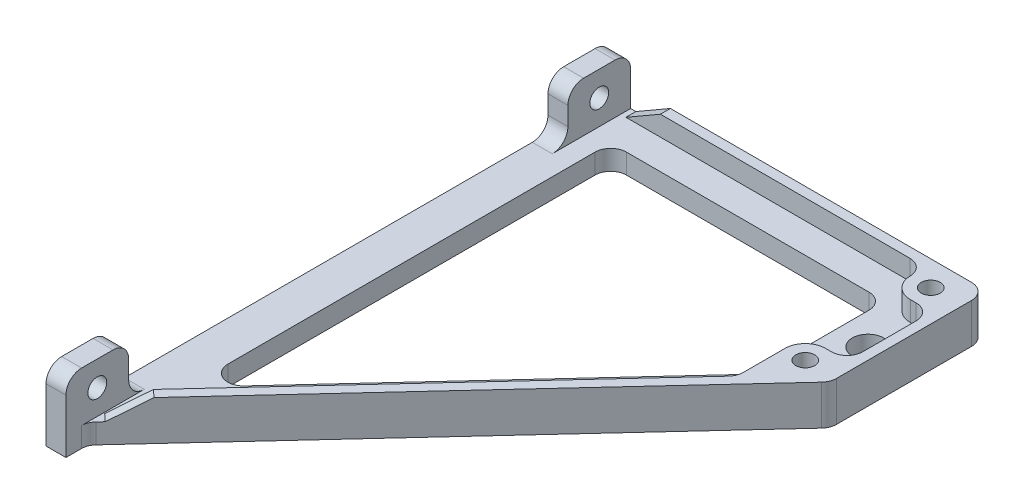
from build123d import *

# Parameters (mm, degrees)
BOSS_EXTRUDE1_DEPTH = 6.35
SKETCH2_R           = 3
CUT_EXTRUDE3_DEPTH  = 217.426251873
BOSS_EXTRUDE3_DEPTH = 6.35
CHAMFER1_SIZE       = 8.660254038
CHAMFER1_SIZE_2     = 15
BOSS_EXTRUDE4_START = 6.35
SKETCH8_R           = 3
BOSS_EXTRUDE4_DEPTH = 6.35
SKETCH9_W           = 6.35
SKETCH9_H           = 20
BOSS_EXTRUDE5_DEPTH = 15.875
SKETCH10_R          = 3
CUT_EXTRUDE4_DEPTH  = 110.875
FILLET3_R           = 5
SKETCH11_R          = 5
CUT_EXTRUDE5_DEPTH  = 15.875


with BuildPart() as part:
    # Sketch1 → Boss-Extrude1 (new body)
    with BuildSketch(Plane(origin=(0, 0, 0), x_dir=(1, 0, 0), z_dir=(0, 1, 0))):
        Polygon((0, 0), (120, 0), (120, -50), (6.35, -173.120833333), (6.35, -180), (0, -180), align=None)
    extrude(amount=BOSS_EXTRUDE1_DEPTH)

    # Sketch2 → Cut-Extrude3 (cut, through all)
    with BuildSketch(Plane(origin=(0, 6.35, 0), x_dir=(1, 0, 0), z_dir=(0, 1, 0))):
        with Locations(Location((110, -8, 0), (0, 0, 270))):
            Circle(SKETCH2_R)
        with Locations(Location((110, -48, 0), (0, 0, 270))):
            Circle(SKETCH2_R)
        Polygon((100, -12.7), (100, -52.942838636), (12.7, -147.517838636), (12.7, -12.7), align=None)
    extrude(amount=-CUT_EXTRUDE3_DEPTH, mode=Mode.SUBTRACT)

    # Sketch7 → Boss-Extrude3 (add)
    with BuildSketch(Plane(origin=(0, 6.35, 0), x_dir=(1, 0, 0), z_dir=(0, 1, 0))):
        Polygon((116.825, -48.758626326), (4.016999063, -170.967294007), (6.35, -173.120833333), (120, -50), (120, 0), (4.016999063, 0), (4.016999063, -3.175), (116.825, -3.175), align=None)
    extrude(amount=BOSS_EXTRUDE3_DEPTH)

    # Chamfer1
    # the kernel refuses this chamfer: 15, 8.660254038 mm, written as the material it takes off along each edge
    with BuildSketch(Plane(origin=(-24.497993798, 12.7, 144.645762136), x_dir=(-0.03926825493809675, -0.9983227437537926, 0.04254060951627175), z_dir=(0.73480344462749, 0, 0.6782801027330635))) as chamfer1_piece_1_section:
        Polygon((CHAMFER1_SIZE * 0.998322743736, CHAMFER1_SIZE * 0.0578938624016), (-CHAMFER1_SIZE_2 * 0.0578938624027, CHAMFER1_SIZE_2 * 0.998322743754), (0, 0), align=None)
    chamfer1_piece_1 = extrude(amount=80.787572639, mode=Mode.PRIVATE)
    chamfer1_piece_1 = split(chamfer1_piece_1, bisect_by=Plane(origin=(8.850305535, 6.35, 168.0716905), z_dir=(0, 1, 0)), keep=Keep.TOP, mode=Mode.PRIVATE)
    add(chamfer1_piece_1, mode=Mode.SUBTRACT)
    with BuildSketch(Plane(origin=(4.016999063, 12.7, -38.80628632), x_dir=(0.9998132206222079, 0.019326765612700747, 0), z_dir=(0, 0, 1))) as chamfer1_piece_2_section:
        Polygon((CHAMFER1_SIZE_2 * 0.999813220622, -CHAMFER1_SIZE_2 * 0.0193267656127), (-CHAMFER1_SIZE * 0.0193267656124, -CHAMFER1_SIZE * 0.999813220604), (0, 0), align=None)
    chamfer1_piece_2 = extrude(amount=80.787572639, mode=Mode.PRIVATE)
    chamfer1_piece_2 = split(chamfer1_piece_2, bisect_by=Plane(origin=(9.423034105, 6.35, 1.5875), z_dir=(0, 1, 0)), keep=Keep.TOP, mode=Mode.PRIVATE)
    add(chamfer1_piece_2, mode=Mode.SUBTRACT)

    # Sketch8 → Boss-Extrude4 (add)
    # profile 1 of 2: a face of its own
    with BuildSketch(Plane(origin=(0, 6.35, 0), x_dir=(1, 0, 0), z_dir=(0, 1, 0)).offset(BOSS_EXTRUDE4_START)):
        with BuildLine():
            Line((110, -14.5), (116.825, -14.5))
            Line((116.825, -14.5), (116.825, -3.175))
            Line((116.825, -3.175), (103.5, -3.175))
            Line((103.5, -3.175), (103.5, -8))
            ThreePointArc((103.5, -8), (105.403805922, -12.596194078), (110, -14.5))
        make_face()
        with Locations(Location((110, -8, 0), (0, 0, 270))):
            Circle(SKETCH8_R, mode=Mode.SUBTRACT)
    # profile 2 of 2: a face of its own
    with BuildSketch(Plane(origin=(0, 6.35, 0), x_dir=(1, 0, 0), z_dir=(0, 1, 0)).offset(BOSS_EXTRUDE4_START)):
        with BuildLine():
            Line((110, -41.5), (116.825, -41.5))
            Line((116.825, -41.5), (116.825, -48.758626326))
            Line((116.825, -48.758626326), (103.5, -63.194042992))
            Line((103.5, -63.194042992), (103.5, -48))
            ThreePointArc((103.5, -48), (105.403805922, -43.403805922), (110, -41.5))
        make_face()
        with Locations(Location((110, -48, 0), (0, 0, 270))):
            Circle(SKETCH8_R, mode=Mode.SUBTRACT)
    extrude(amount=-BOSS_EXTRUDE4_DEPTH)

    # Sketch9 → Boss-Extrude5 (add)
    with BuildSketch(Plane(origin=(0, 6.35, 0), x_dir=(1, 0, 0), z_dir=(0, 1, 0))):
        with Locations((3.175, -10)):
            Rectangle(SKETCH9_W, SKETCH9_H)
        with Locations((3.175, -170)):
            Rectangle(SKETCH9_W, SKETCH9_H)
    extrude(amount=BOSS_EXTRUDE5_DEPTH)

    # Sketch10 → Cut-Extrude4 (cut)
    with BuildSketch(Plane(origin=(6.35, 0, 0), x_dir=(0, 0, -1), z_dir=(1, 0, 0))):
        with Locations((-10, 14.2875)):
            Circle(SKETCH10_R)
        with Locations((-170, 14.2875)):
            Circle(SKETCH10_R)
    extrude(amount=-CUT_EXTRUDE4_DEPTH, mode=Mode.SUBTRACT)

    # Fillet3
    fillet3_edges = [part.edges().sort_by_distance(p)[0] for p in [
        (103.5, 9.525, 63.194042992),
        (116.825, 9.525, 41.5),
        (116.825, 9.525, 14.5),
        (103.5, 9.525, 3.175),
        (120, 6.35, 0),
        (120, 6.35, 50),
        (6.35, 3.175, 173.120833333),
        (12.7, 3.175, 147.517838636),
        (100, 3.175, 52.942838636),
        (100, 3.175, 12.7),
        (12.7, 3.175, 12.7),
        (3.175, 22.225, 180),
        (3.175, 6.35, 160),
        (3.175, 22.225, 160),
        (3.175, 22.225, 0),
        (3.175, 22.225, 20),
        (3.175, 6.35, 20),
    ]]
    fillet(fillet3_edges, radius=FILLET3_R)

    # Sketch11 → Cut-Extrude5 (cut)
    with BuildSketch(Plane(origin=(0, 6.35, 0), x_dir=(1, 0, 0), z_dir=(0, 1, 0))):
        with Locations(Location((110, -28, 0), (0, 0, 270))):
            Circle(SKETCH11_R)
    extrude(amount=-CUT_EXTRUDE5_DEPTH, mode=Mode.SUBTRACT)


solid = part.part
